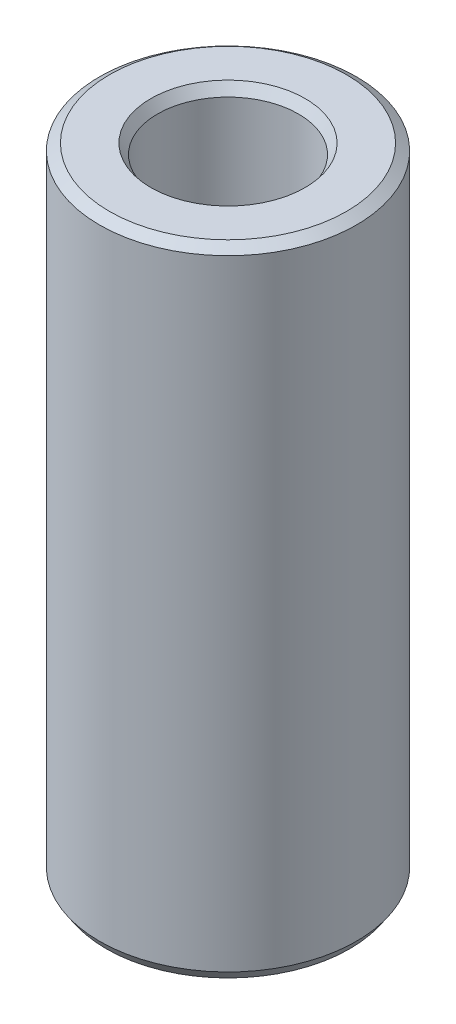
from build123d import *
from OCP.BRepFilletAPI import BRepFilletAPI_MakeChamfer

# Parameters (mm, degrees)
SKETCH1_R           = 47.5
BOSS_EXTRUDE1_DEPTH = 235.56054021
SKETCH2_R           = 26.044956651
CUT_EXTRUDE1_DEPTH  = 245.951562771
CHAMFER1_SIZE       = 2.495548028
CHAMFER1_SIZE2      = 3.682893562


with BuildPart() as part:
    # Sketch1 → Boss-Extrude1 (new body)
    with BuildSketch(Plane(origin=(0, 0, 0), x_dir=(1, 0, 0), z_dir=(0, 1, 0))):
        Circle(SKETCH1_R)
    extrude(amount=BOSS_EXTRUDE1_DEPTH)

    # Sketch2 → Cut-Extrude1 (cut, through all)
    with BuildSketch(Plane(origin=(0, 0, 0), x_dir=(1, 0, 0), z_dir=(0, 1, 0))):
        Circle(SKETCH2_R)
    extrude(amount=CUT_EXTRUDE1_DEPTH, mode=Mode.SUBTRACT)

    # Chamfer1: one chamfer whose edges measure the first distance from different faces: ONE call of the kernel's chamfer builder (chamfer() names one face for all edges)
    chamfer1_edges_1 = [part.edges().sort_by_distance(p)[0] for p in [
        (-26.044956651, 235.56054021, 0),
    ]]
    chamfer1_side_1 = [part.faces().sort_by_distance(p)[0] for p in [
        (-46.156497116, 235.56054021, 0),
    ]]
    chamfer1_edges_2 = [part.edges().sort_by_distance(p)[0] for p in [
        (-26.044956651, 0, 0),
    ]]
    chamfer1_side_2 = [part.faces().sort_by_distance(p)[0] for p in [
        (-26.044956651, 117.780270105, 0),
    ]]
    chamfer1_edges_3 = [part.edges().sort_by_distance(p)[0] for p in [
        (-47.5, 0, 0),
    ]]
    chamfer1_side_3 = [part.faces().sort_by_distance(p)[0] for p in [
        (-46.156497116, 0, 0),
    ]]
    chamfer1_edges_4 = [part.edges().sort_by_distance(p)[0] for p in [
        (-47.5, 235.56054021, 0),
    ]]
    chamfer1_side_4 = [part.faces().sort_by_distance(p)[0] for p in [
        (-47.5, 117.780270105, 0),
    ]]
    chamfer1 = BRepFilletAPI_MakeChamfer(part.part.solid().wrapped)
    for e in chamfer1_edges_1:
        chamfer1.Add(CHAMFER1_SIZE, CHAMFER1_SIZE2, e.wrapped, chamfer1_side_1[0].wrapped)  # the first distance lies on this face
    for e in chamfer1_edges_2:
        chamfer1.Add(CHAMFER1_SIZE, CHAMFER1_SIZE2, e.wrapped, chamfer1_side_2[0].wrapped)  # the first distance lies on this face
    for e in chamfer1_edges_3:
        chamfer1.Add(CHAMFER1_SIZE, CHAMFER1_SIZE2, e.wrapped, chamfer1_side_3[0].wrapped)  # the first distance lies on this face
    for e in chamfer1_edges_4:
        chamfer1.Add(CHAMFER1_SIZE, CHAMFER1_SIZE2, e.wrapped, chamfer1_side_4[0].wrapped)  # the first distance lies on this face
    add(Compound.cast(chamfer1.Shape()), mode=Mode.REPLACE)


solid = part.part
